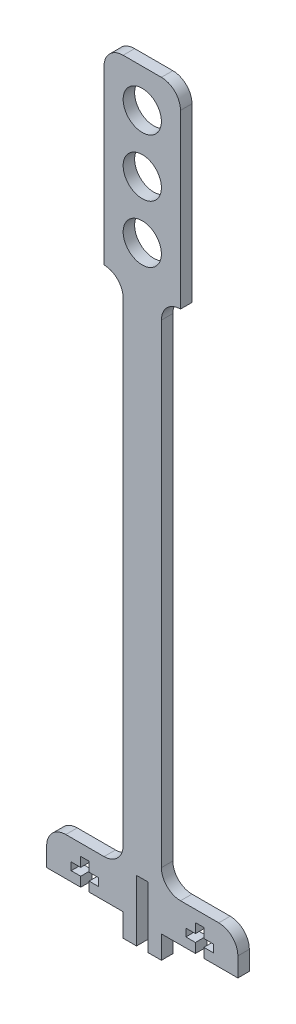
from build123d import *

# Parameters (mm, degrees)
SKETCH1_R           = 5
BOSS_EXTRUDE1_DEPTH = 3
FILLET1_START       = -1
FILLET1_DEPTH       = 5
FILLET1_2_DEPTH     = 3


with BuildPart() as part:
    # Sketch1 → Boss-Extrude1 (new body)
    with BuildSketch(Plane.XY):
        Polygon((-5, -25), (-5, -159), (-25, -159), (-25, -169), (-16.1, -169), (-16.1, -166.5), (-18.6, -166.5), (-18.6, -164.5), (-16.1, -164.5), (-16.1, -162), (-13.9, -162), (-13.9, -164.5), (-11.4, -164.5), (-11.4, -166.5), (-13.9, -166.5), (-13.9, -169), (-5, -169), (-5, -175), (-1.5, -175), (-1.5, -159), (1.5, -159), (1.5, -175), (5, -175), (5, -169), (13.9, -169), (13.9, -166.5), (11.4, -166.5), (11.4, -164.5), (13.9, -164.5), (13.9, -162), (16.1, -162), (16.1, -164.5), (18.6, -164.5), (18.6, -166.5), (16.1, -166.5), (16.1, -169), (25, -169), (25, -159), (5, -159), (5, -25), (10, -25), (10, 25), (-10, 25), (-10, -25), align=None)
        with Locations((0, 15)):
            Circle(SKETCH1_R, mode=Mode.SUBTRACT)
        Circle(SKETCH1_R, mode=Mode.SUBTRACT)
        with Locations((0, -15)):
            Circle(SKETCH1_R, mode=Mode.SUBTRACT)
    extrude(amount=BOSS_EXTRUDE1_DEPTH)

    # Fillet1: read off the stored shape, not the designer's step
    # Fillet1 outline → Fillet1 (cut)
    with BuildSketch(Plane.XY.offset(FILLET1_START)):
        with BuildLine():
            Line((25, -159), (20, -159))
            ThreePointArc((20, -159), (23.535533906, -160.464466094), (25, -164))
            Line((25, -164), (25, -159))
        make_face()
        with BuildLine():
            ThreePointArc((-25, -164), (-23.535533906, -160.464466094), (-20, -159))
            Line((-20, -159), (-25, -159))
            Line((-25, -159), (-25, -164))
        make_face()
        with BuildLine():
            ThreePointArc((-10, 20), (-8.535533906, 23.535533906), (-5, 25))
            Line((-5, 25), (-10, 25))
            Line((-10, 25), (-10, 20))
        make_face()
        with BuildLine():
            ThreePointArc((5, 25), (8.535533906, 23.535533906), (10, 20))
            Line((10, 20), (10, 25))
            Line((10, 25), (5, 25))
        make_face()
    extrude(amount=FILLET1_DEPTH, mode=Mode.SUBTRACT)

    # Fillet1 2 outline → Fillet1 2 (add)
    with BuildSketch(Plane.XY):
        with BuildLine():
            Line((-5, -159), (-5, -154))
            ThreePointArc((-5, -154), (-6.464466094, -157.535533906), (-10, -159))
            Line((-10, -159), (-5, -159))
        make_face()
        with BuildLine():
            Line((-5, -25), (-10, -25))
            ThreePointArc((-10, -25), (-6.464466094, -26.464466094), (-5, -30))
            Line((-5, -30), (-5, -25))
        make_face()
        with BuildLine():
            Line((5, -25), (5, -30))
            ThreePointArc((5, -30), (6.464466094, -26.464466094), (10, -25))
            Line((10, -25), (5, -25))
        make_face()
        with BuildLine():
            Line((5, -159), (10, -159))
            ThreePointArc((10, -159), (6.464466094, -157.535533906), (5, -154))
            Line((5, -154), (5, -159))
        make_face()
    extrude(amount=FILLET1_2_DEPTH)


solid = part.part
